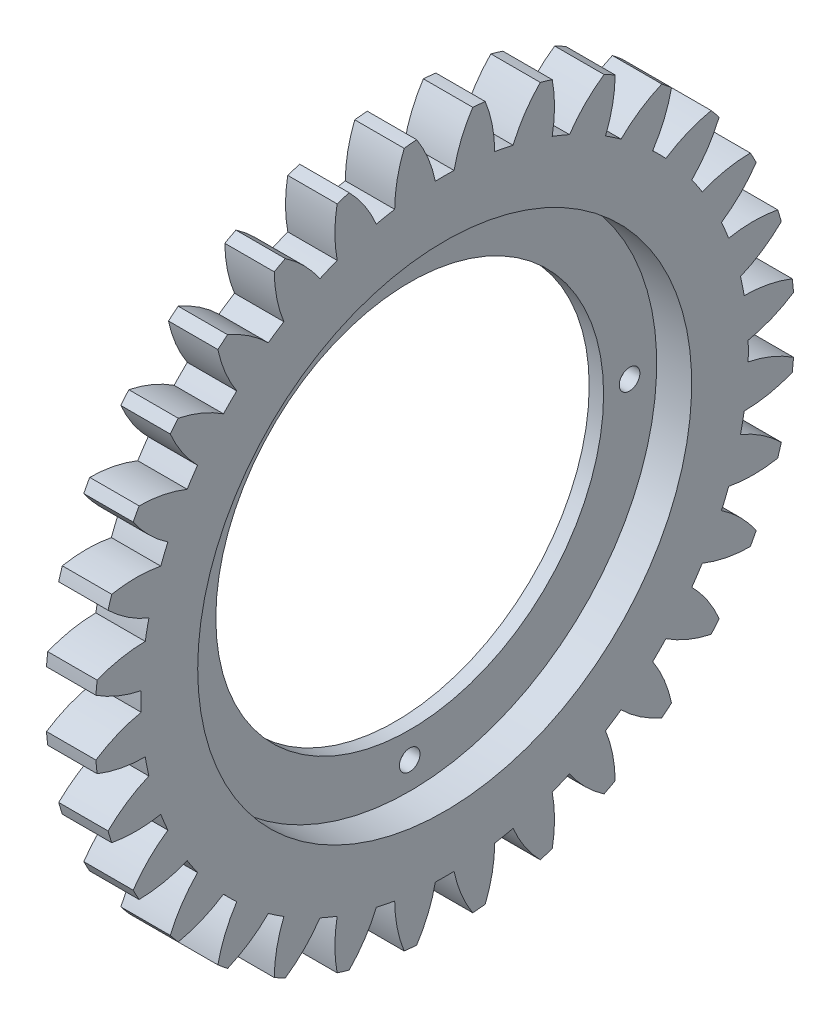
from build123d import *

# Parameters (mm, degrees)
TOOTHCUT_DEPTH     = 121.805629008
TEETHCUTS_COUNT    = 32
TEETHCUTS_ANGLE    = 348.75
BORSKE_R           = 47.1
BORE_DEPTH         = 50.0000508
CUT_EXTRUDE1_REACH = 122.421
SKETCH1_R          = 2.5


with BuildPart() as part:
    # BasProSke → Base-Revolve (revolve)
    with BuildSketch(Plane(origin=(0, 0, 0), x_dir=(1, 0, 0), z_dir=(0, 1, 0))):
        Polygon((0, 0), (0, 85), (12, 85), (12, 60), (3.5, 60), (3.5, 0), align=None)
    revolve(axis=Axis((-10, 0, 0), (1, 0, 0)))

    # TooCutSke → ToothCut (cut, through all)
    with BuildSketch(Plane(origin=(0, 0, 0), x_dir=(0, 0, -1), z_dir=(1, 0, 0))):
        with BuildLine():
            ThreePointArc((2.273882543, 73.713936669), (0, 73.749), (-2.273882543, 73.713936669))
            ThreePointArc((-2.273882543, 73.713936669), (-4.031320982, 79.446636556), (-6.827354076, 84.750845904))
            ThreePointArc((-6.827354076, 84.750845904), (0, 85.0254), (6.827354076, 84.750845904))
            ThreePointArc((6.827354076, 84.750845904), (4.031320982, 79.446636556), (2.273882543, 73.713936669))
        make_face()
    toothcut = extrude(amount=TOOTHCUT_DEPTH, mode=Mode.SUBTRACT)

    # TeethCuts: ToothCut ×32 about axis
    teethcuts_axis = Axis((-10, 0, 0), (1, 0, 0))
    for i in range(1, TEETHCUTS_COUNT):
        add(toothcut.rotate(teethcuts_axis, i * TEETHCUTS_ANGLE / (TEETHCUTS_COUNT - 1)), mode=Mode.SUBTRACT)

    # BorSke → Bore (cut, symmetric)
    with BuildSketch(Plane(origin=(0, 0, 0), x_dir=(0, 0, -1), z_dir=(1, 0, 0))):
        Circle(BORSKE_R)
    extrude(amount=BORE_DEPTH, both=True, mode=Mode.SUBTRACT)

    # Sketch1 → Cut-Extrude1 (cut, up to next)
    with BuildSketch(Plane(origin=(12, 0, 0), x_dir=(0, 0, -1), z_dir=(1, 0, 0)), mode=Mode.PRIVATE) as cut_extrude1_sk1:
        with Locations((0, 53.4)):
            Circle(SKETCH1_R)
    cut_extrude1_tool1 = extrude(cut_extrude1_sk1.sketch, amount=-CUT_EXTRUDE1_REACH, mode=Mode.PRIVATE) & part.part
    # Sketch1 → Cut-Extrude1 (cut, up to next)
    with BuildSketch(Plane(origin=(12, 0, 0), x_dir=(0, 0, -1), z_dir=(1, 0, 0)), mode=Mode.PRIVATE) as cut_extrude1_sk2:
        with Locations((53.4, 0)):
            Circle(SKETCH1_R)
    cut_extrude1_tool2 = extrude(cut_extrude1_sk2.sketch, amount=-CUT_EXTRUDE1_REACH, mode=Mode.PRIVATE) & part.part
    # Sketch1 → Cut-Extrude1 (cut, up to next)
    with BuildSketch(Plane(origin=(12, 0, 0), x_dir=(0, 0, -1), z_dir=(1, 0, 0)), mode=Mode.PRIVATE) as cut_extrude1_sk3:
        with Locations((0, -53.4)):
            Circle(SKETCH1_R)
    cut_extrude1_tool3 = extrude(cut_extrude1_sk3.sketch, amount=-CUT_EXTRUDE1_REACH, mode=Mode.PRIVATE) & part.part
    # Sketch1 → Cut-Extrude1 (cut, up to next)
    with BuildSketch(Plane(origin=(12, 0, 0), x_dir=(0, 0, -1), z_dir=(1, 0, 0)), mode=Mode.PRIVATE) as cut_extrude1_sk4:
        with Locations((-53.4, 0)):
            Circle(SKETCH1_R)
    cut_extrude1_tool4 = extrude(cut_extrude1_sk4.sketch, amount=-CUT_EXTRUDE1_REACH, mode=Mode.PRIVATE) & part.part
    add(cut_extrude1_tool1.solids().sort_by_distance((12, 53.4, 0))[0], mode=Mode.SUBTRACT)
    add(cut_extrude1_tool2.solids().sort_by_distance((12, 0, -53.4))[0], mode=Mode.SUBTRACT)
    add(cut_extrude1_tool3.solids().sort_by_distance((12, -53.4, 0))[0], mode=Mode.SUBTRACT)
    add(cut_extrude1_tool4.solids().sort_by_distance((12, 0, 53.4))[0], mode=Mode.SUBTRACT)


solid = part.part
